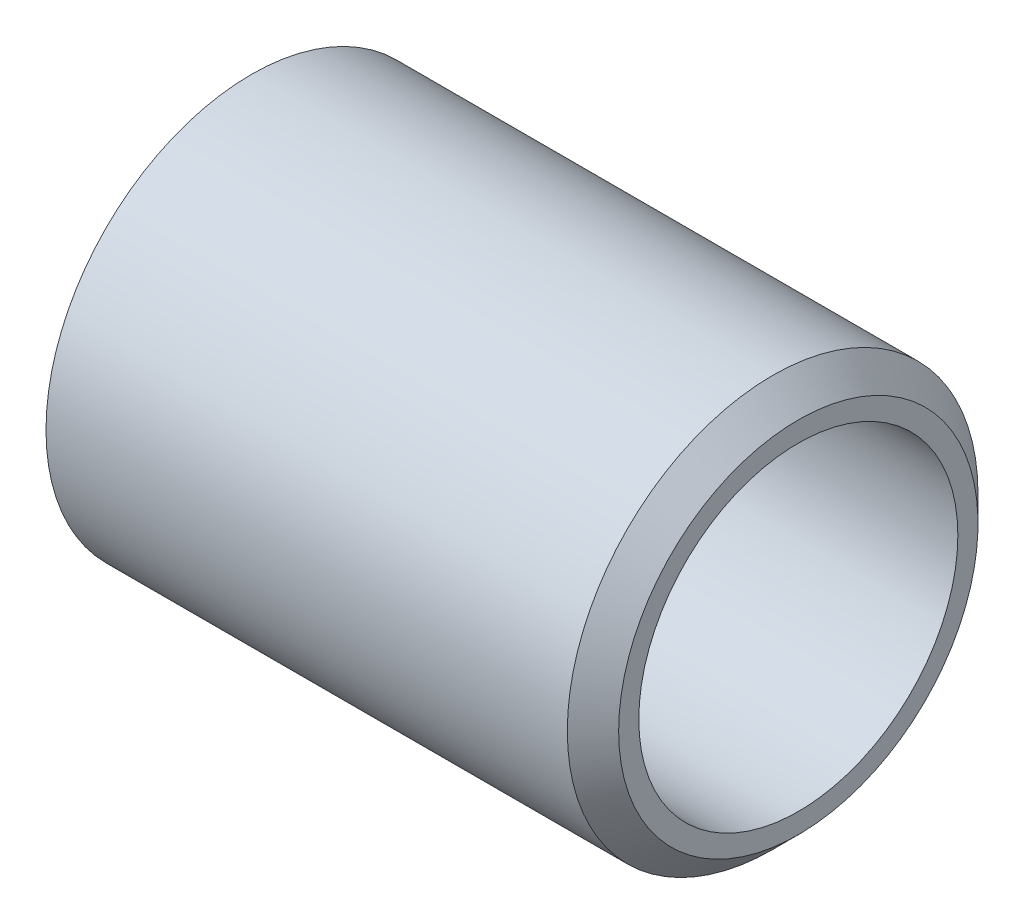
from build123d import *


with BuildPart() as part:
    # Sketch1 → BaseBody (revolve)
    with BuildSketch(Plane.XY):
        with BuildLine():
            Line((0, 24.6126), (0, 28.60675))
            Line((0, 28.60675), (72.62415625, 28.60675))
            Line((72.62415625, 28.60675), (76.2, 25.03090625))
            Line((76.2, 25.03090625), (76.2, 22.225))
            Line((76.2, 22.225), (2.3876, 22.225))
            ThreePointArc((2.3876, 22.225), (0.699311849, 22.924311849), (0, 24.6126))
        make_face()
    revolve(axis=Axis((0, 0, 0), (1, 0, 0)))


solid = part.part
